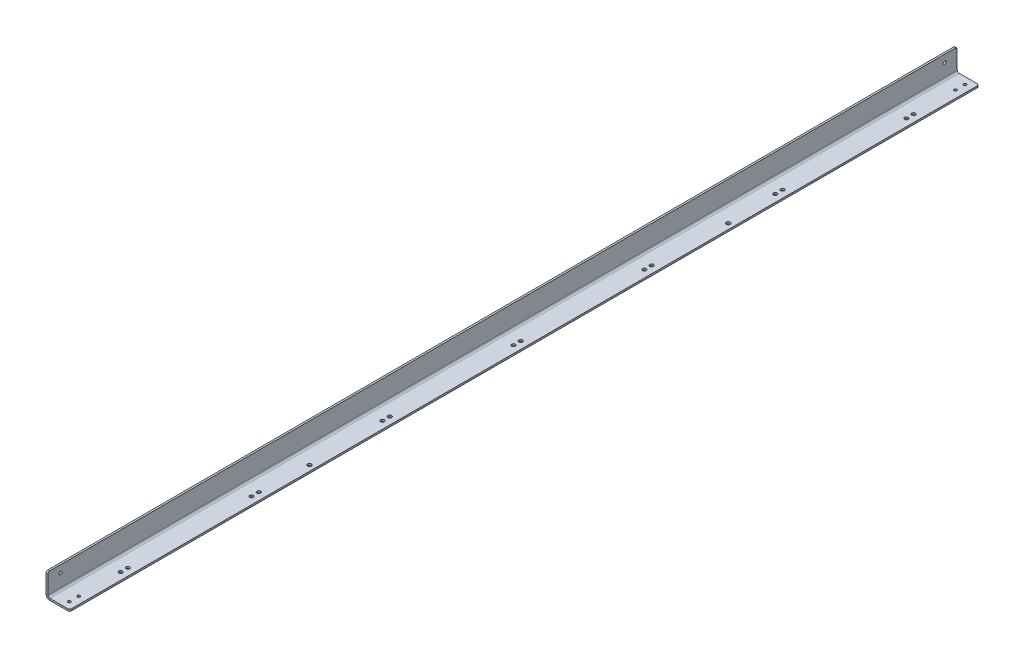
from build123d import *

# Parameters (mm, degrees)
BASE_FLANGE1_DEPTH               = 793.75
E_0_25_DIAMETER_HOLE1_D          = 6.35
F_10_0_1935_DIAMETER_HOLE1_D     = 4.9149
FILLET1_R                        = 3.175
F_17_64_0_26563_DIAMETER_HOLE2_D = 6.747002
F_10_0_1935_DIAMETER_HOLE2_D     = 4.9149


# Sheet-metal steps are written as plain solids
with BuildPart() as part:
    # Sketch1 → Base-Flange1 (new, symmetric)
    with BuildSketch(Plane.XY):
        with BuildLine():
            Line((0, 0), (-34.925, 0))
            ThreePointArc((-34.925, 0), (-39.415128061, 1.859871939), (-41.275, 6.35))
            Line((-41.275, 6.35), (-41.275, 41.275))
            Line((-41.275, 41.275), (-38.1, 41.275))
            Line((-38.1, 41.275), (-38.1, 6.35))
            ThreePointArc((-38.1, 6.35), (-37.17006403, 4.10493597), (-34.925, 3.175))
            Line((-34.925, 3.175), (0, 3.175))
            Line((0, 3.175), (0, 0))
        make_face()
    extrude(amount=BASE_FLANGE1_DEPTH, both=True)

    # E (0.25) Diameter Hole1 (through all)
    with Locations(Plane(origin=(0, 3.175, 0), x_dir=(1, 0, 0), z_dir=(0, 1, 0))):
        with Locations((-12.7, 6.35), (-12.7, -6.35), (-12.7, 234.95), (-12.7, 222.25), (-12.7, 463.55), (-12.7, 450.85), (-12.7, 692.15), (-12.7, 679.45), (-12.7, -222.25), (-12.7, -234.95), (-12.7, -450.85), (-12.7, -463.55), (-12.7, -679.45), (-12.7, -692.15)):
            Hole(E_0_25_DIAMETER_HOLE1_D / 2)

    # #10 (0.1935) Diameter Hole1 (through all)
    with Locations(Plane(origin=(0, 3.175, 0), x_dir=(1, 0, 0), z_dir=(0, 1, 0))):
        with Locations((-12.7, -765.175), (-12.7, -781.685), (-12.7, 781.685), (-12.7, 765.175)):
            Hole(F_10_0_1935_DIAMETER_HOLE1_D / 2)

    # Fillet1
    fillet1_edges = [part.edges().sort_by_distance(p)[0] for p in [
        (0, 1.5875, 793.75),
        (0, 1.5875, -793.75),
        (-39.6875, 41.275, 793.75),
        (-39.6875, 41.275, -793.75),
    ]]
    fillet(fillet1_edges, radius=FILLET1_R)

    # 17/64 (0.26563) Diameter Hole2 (through all)
    with Locations(Plane(origin=(0, 3.175, 0), x_dir=(1, 0, 0), z_dir=(0, 1, 0))):
        with Locations((-9.525, 365.4425), (-9.525, -365.4425)):
            Hole(F_17_64_0_26563_DIAMETER_HOLE2_D / 2)

    # #10 (0.1935) Diameter Hole2 (through all)
    with Locations(Plane(origin=(-38.1, 0, 0), x_dir=(0, 0, -1), z_dir=(1, 0, 0))):
        with Locations((-771.525, 28.575), (771.525, 28.575)):
            Hole(F_10_0_1935_DIAMETER_HOLE2_D / 2)


solid = part.part
